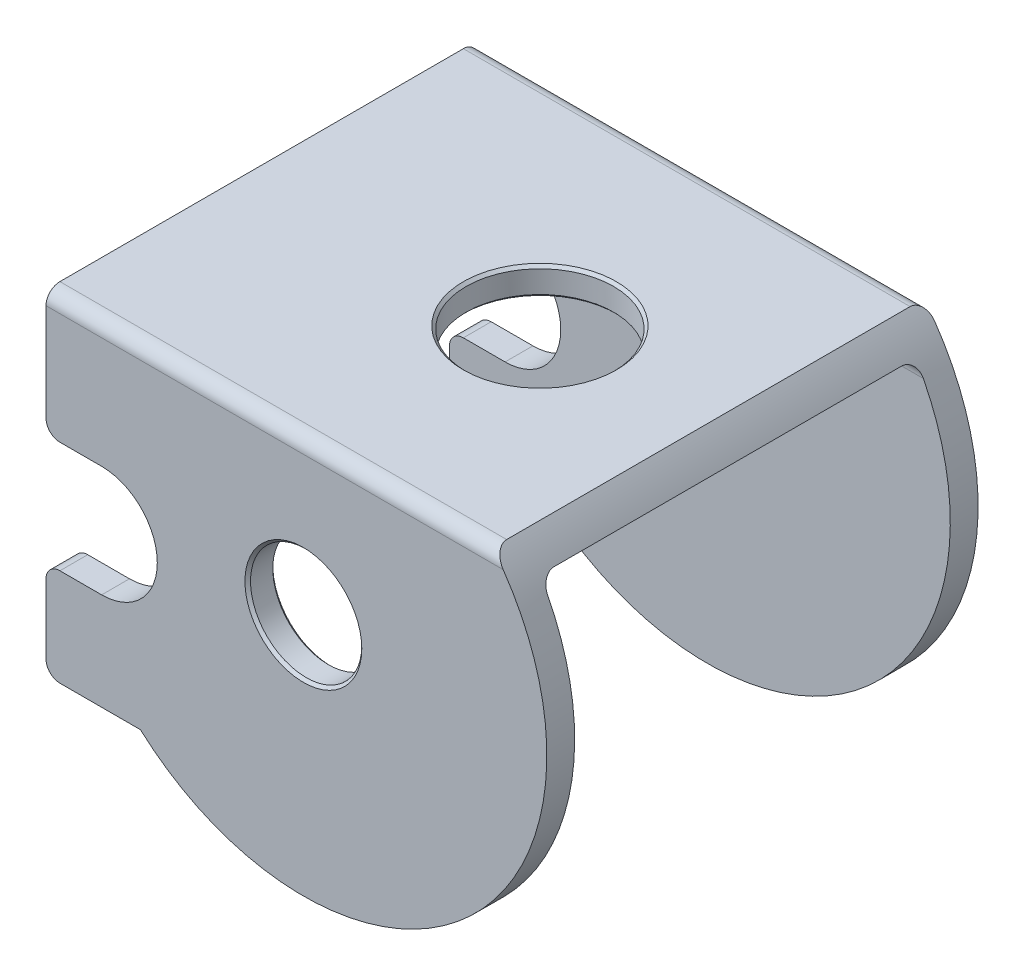
from build123d import *

# Parameters (mm, degrees)
GEARA_W_DEPTH       = 15.5
SKETCH_2_R          = 4
CUT_EXTRUDE_1_DEPTH = 41.118574252
GEARA_T_W           = 27
GEARA_T_H           = 26.5
CUT_EXTRUDE_2_DEPTH = 43.924352063
CUT_EXTRUDE_3_REACH = 39.346
SKETCH_4_R          = 5.3
FILLET_1_R          = 1
FILLET_2_R          = 1
CHAMFER_1_SIZE      = 0.2


with BuildPart() as part:
    # ｽｹｯﾁ1 → GearA-W (new, symmetric)
    with BuildSketch(Plane.XY):
        with BuildLine():
            Line((-18.5, 11), (-18.5, -13))
            Line((-18.5, -13), (-11.715374514, -13))
            ThreePointArc((-11.715374514, -13), (12.037359531, -12.702439747), (13.610657589, 11))
            Line((13.610657589, 11), (-18.5, 11))
        make_face()
    extrude(amount=GEARA_W_DEPTH, both=True)

    # ｽｹｯﾁ2 → ｶｯﾄ - 押し出し1 (cut, through all)
    with BuildSketch(Plane.XY.offset(15.5)):
        Circle(SKETCH_2_R)
        with BuildLine():
            Line((-18.5, 2), (-14.5, 2))
            ThreePointArc((-14.5, 2), (-10.5, -2), (-14.5, -6))
            Line((-14.5, -6), (-18.5, -6))
            Line((-18.5, -6), (-18.5, 2))
        make_face()
    extrude(amount=-CUT_EXTRUDE_1_DEPTH, mode=Mode.SUBTRACT)

    # GearA-t → ｶｯﾄ - 押し出し2 (cut, through all)
    with BuildSketch(Plane.ZY.offset(18.5)):
        with Locations((0, -4.25)):
            Rectangle(GEARA_T_W, GEARA_T_H)
    extrude(amount=-CUT_EXTRUDE_2_DEPTH, mode=Mode.SUBTRACT)

    # ｽｹｯﾁ4 → ｶｯﾄ - 押し出し3 (cut, up to next)
    with BuildSketch(Plane(origin=(0, 11, 0), x_dir=(1, 0, 0), z_dir=(0, 1, 0)), mode=Mode.PRIVATE) as cut_extrude_3_sk1:
        with Locations((1.5, 0)):
            Circle(SKETCH_4_R)
    cut_extrude_3_tool1 = extrude(cut_extrude_3_sk1.sketch, amount=-CUT_EXTRUDE_3_REACH, mode=Mode.PRIVATE) & part.part
    add(cut_extrude_3_tool1.solids().sort_by_distance((1.5, 11, 0))[0], mode=Mode.SUBTRACT)

    # ﾌｨﾚｯﾄ1
    fillet_1_edges = [part.edges().sort_by_distance(p)[0] for p in [
        (-18.5, -13, -14.5),
        (-18.5, -13, 14.5),
        (-18.5, -6, -14.5),
        (-18.5, -6, 14.5),
        (-18.5, 2, -14.5),
        (-18.5, 2, 14.5),
    ]]
    fillet(fillet_1_edges, radius=FILLET_1_R)

    # ﾌｨﾚｯﾄ2
    fillet_2_edges = [part.edges().sort_by_distance(p)[0] for p in [
        (-2.444671206, 11, -15.5),
        (-2.444671206, 11, 15.5),
        (-1.74583449, 9, -13.5),
        (-1.74583449, 9, 13.5),
    ]]
    fillet(fillet_2_edges, radius=FILLET_2_R)

    # 面取り1
    chamfer_1_edges = [part.edges().sort_by_distance(p)[0] for p in [
        (-4, 0, 15.5),
        (-4, 0, -15.5),
        (-3.8, 11, 0),
        (-4, 0, 13.5),
        (-3.8, 9, 0),
        (-4, 0, -13.5),
    ]]
    chamfer(chamfer_1_edges, length=CHAMFER_1_SIZE)


solid = part.part
